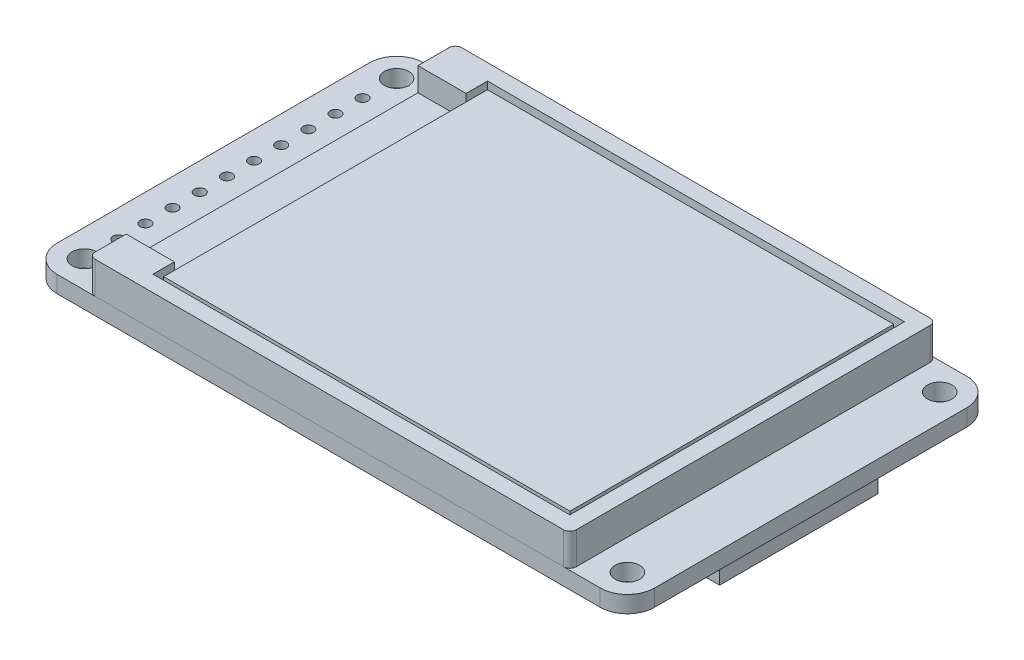
from build123d import *

# Parameters (mm, degrees)
SKETCH1_W                                     = 55.88
SKETCH1_H                                     = 34.29
CIRCUIT_BOARD_DEPTH                           = 1.57
FILLET1_R                                     = 2.54
SKETCH2_R                                     = 1.143
CUT_EXTRUDE1_DEPTH                            = 66.580815792
SKETCH3_R                                     = 0.5
CUT_EXTRUDE2_DEPTH                            = 66.580815792
CONNECTOR_HOLES_COUNT                         = 10
CONNECTOR_HOLES_PITCH                         = 2.54
SKETCH4_W                                     = 7.083224401
SKETCH4_H                                     = 9.821277531
SKETCH4_W_2                                   = 14.273419681
SKETCH4_H_2                                   = 14.821200637
IC1_AND_SD_CARD_SLOT_APPROXIMATE_SIZE_A_DEPTH = 2
SKETCH5_W                                     = 45
SKETCH5_H                                     = 34.29
BOSS_EXTRUDE3_DEPTH                           = 3
CUT_EXTRUDE3_DEPTH                            = 2.2
SKETCH7_W                                     = 38
SKETCH7_H                                     = 30.29
BOSS_EXTRUDE4_DEPTH                           = 2
FILLET2_R                                     = 0.6


with BuildPart() as part:
    # Sketch1 → Circuit Board (new body)
    with BuildSketch(Plane(origin=(0, 0, 0), x_dir=(1, 0, 0), z_dir=(0, 1, 0))):
        with Locations((27.94, 17.145)):
            Rectangle(SKETCH1_W, SKETCH1_H)
    extrude(amount=CIRCUIT_BOARD_DEPTH)

    # Fillet1
    fillet1_edges = [part.edges().sort_by_distance(p)[0] for p in [
        (0, 0.785, -34.29),
        (55.88, 0.785, -34.29),
        (0, 0.785, 0),
        (55.88, 0.785, 0),
    ]]
    fillet(fillet1_edges, radius=FILLET1_R)

    # Sketch2 → Cut-Extrude1 (cut, through all)
    with BuildSketch(Plane(origin=(0, 1.57, 0), x_dir=(1, 0, 0), z_dir=(0, 1, 0))):
        with Locations((2.54, 31.75)):
            Circle(SKETCH2_R)
        with Locations((53.34, 31.75)):
            Circle(SKETCH2_R)
        with Locations((53.34, 2.54)):
            Circle(SKETCH2_R)
        with Locations((2.54, 2.54)):
            Circle(SKETCH2_R)
    extrude(amount=-CUT_EXTRUDE1_DEPTH, mode=Mode.SUBTRACT)

    # Sketch3 → Cut-Extrude2 (cut, through all)
    with BuildSketch(Plane(origin=(0, 1.57, 0), x_dir=(1, 0, 0), z_dir=(0, 1, 0))):
        with Locations((2.54, 5.715)):
            Circle(SKETCH3_R)
    cut_extrude2 = extrude(amount=-CUT_EXTRUDE2_DEPTH, mode=Mode.SUBTRACT)

    # Connector Holes: Cut-Extrude2 ×10
    with Locations(*[(0, 0, -i * CONNECTOR_HOLES_PITCH) for i in range(1, CONNECTOR_HOLES_COUNT)]):
        add(cut_extrude2, mode=Mode.SUBTRACT)

    # Sketch4 → IC1 and SD card slot (approximate size and location) (add)
    with BuildSketch(Plane.XZ):
        with Locations((19.457987587, -17.502137365)):
            Rectangle(SKETCH4_W, SKETCH4_H)
        with Locations((47.993177866, -16.787862636)):
            Rectangle(SKETCH4_W_2, SKETCH4_H_2)
    extrude(amount=IC1_AND_SD_CARD_SLOT_APPROXIMATE_SIZE_A_DEPTH)


with BuildPart() as body_2:
    # Sketch5 → Boss-Extrude3 (new body)
    with BuildSketch(Plane(origin=(0, 1.57, 0), x_dir=(1, 0, 0), z_dir=(0, 1, 0))):
        with Locations((28, 17.145)):
            Rectangle(SKETCH5_W, SKETCH5_H)
    extrude(amount=BOSS_EXTRUDE3_DEPTH)

    # Sketch6 → Cut-Extrude3 (cut)
    with BuildSketch(Plane(origin=(0, 4.57, 0), x_dir=(1, 0, 0), z_dir=(0, 1, 0))):
        Polygon((10, 32.79), (10, 30.79), (5.5, 30.79), (5.5, 3.5), (10, 3.5), (10, 1.5), (49, 1.5), (49, 32.79), align=None)
    extrude(amount=-CUT_EXTRUDE3_DEPTH, mode=Mode.SUBTRACT)

    # Sketch7 → Boss-Extrude4 (add)
    with BuildSketch(Plane(origin=(0, 2.37, 0), x_dir=(1, 0, 0), z_dir=(0, 1, 0))):
        with Locations((29.5, 17.145)):
            Rectangle(SKETCH7_W, SKETCH7_H)
    extrude(amount=BOSS_EXTRUDE4_DEPTH)

    # Fillet2
    fillet2_edges = [body_2.edges().sort_by_distance(p)[0] for p in [
        (50.5, 3.07, 0),
        (50.5, 3.07, -34.29),
        (5.5, 3.07, -34.29),
        (5.5, 3.07, 0),
    ]]
    fillet(fillet2_edges, radius=FILLET2_R)


solid = Compound([part.part, body_2.part])
